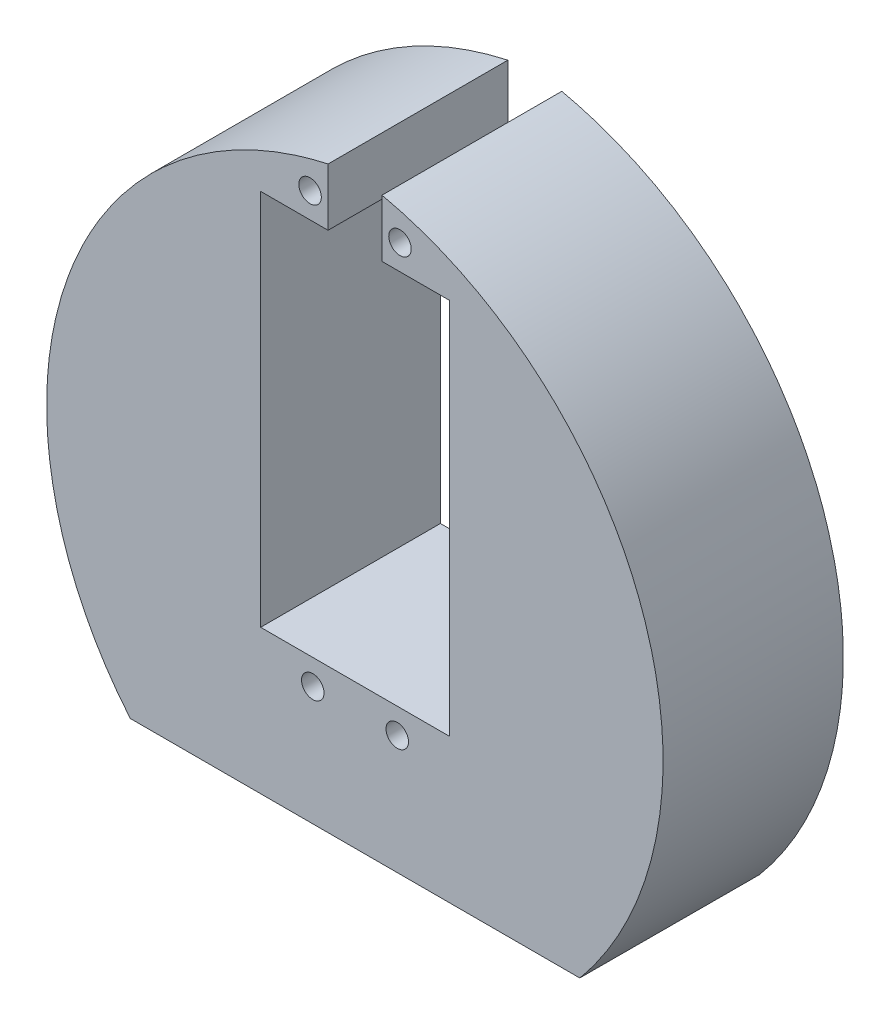
from build123d import *

# Parameters (mm, degrees)
SKETCH5_R          = 1.25
CUT_EXTRUDE1_DEPTH = 22
SKETCH6_R          = 7
CUT_EXTRUDE2_DEPTH = 15


with BuildPart() as part:
    # Surface-Knit1: read off the stored shape, not the designer's step
    # Surface-Knit1: loft between two sections, ruled curve by curve
    surface_knit1_from = [
        Edge.make_bspline([(2.083333333, 65, 0), (0.646232747, 64.800559216, 0), (-0.826702854, 64.515993467, 0), (-3.818616425, 63.749425521, 0), (-5.337603105, 63.267310443, 0), (-8.386455572, 62.082263598, 0), (-9.916283922, 61.37920281, 0), (-12.942411074, 59.736543691, 0), (-14.438613707, 58.796821883, 0), (-17.345798661, 56.676662259, 0), (-18.756625413, 55.496137115, 0), (-21.437875212, 52.905022069, 0), (-22.708100878, 51.494412766, 0), (-25.054855252, 48.47033026, 0), (-26.131181002, 46.856926203, 0), (-28.044894258, 43.470320821, 0), (-28.882119317, 41.697275034, 0), (-30.286104482, 38.046913607, 0), (-30.852782543, 36.169811281, 0), (-31.701669093, 32.373657167, 0), (-31.983893935, 30.454829684, 0), (-32.268420202, 26.637582521, 0), (-32.270825943, 24.73935017, 0), (-32.016934112, 21.019334498, 0), (-31.760796053, 19.197669041, 0), (-31.023611092, 15.67582868, 0), (-30.542738185, 13.975693203, 0), (-29.397291667, 10.728582673, 0), (-28.732872183, 9.18158041, 0), (-27.26390999, 6.258912542, 0), (-26.459481527, 4.883176255, 0), (-24.752359253, 2.309286831, 0), (-23.849734618, 1.111044068, 0), (-22.916666667, 0, 0)], [0, 0, 0, 0, 0.0625, 0.0625, 0.125, 0.125, 0.1875, 0.1875, 0.25, 0.25, 0.3125, 0.3125, 0.375, 0.375, 0.4375, 0.4375, 0.5, 0.5, 0.5625, 0.5625, 0.625, 0.625, 0.6875, 0.6875, 0.75, 0.75, 0.8125, 0.8125, 0.875, 0.875, 0.9375, 0.9375, 1, 1, 1, 1], 3),
        Edge.make_bspline([(27.083333333, 0, 0), (28.016401284, 1.111044068, 0), (28.91902592, 2.309286831, 0), (30.626148194, 4.883176255, 0), (31.430576657, 6.258912542, 0), (32.89953885, 9.18158041, 0), (33.563958334, 10.728582673, 0), (34.709404851, 13.975693203, 0), (35.190277759, 15.67582868, 0), (35.92746272, 19.197669041, 0), (36.183600779, 21.019334498, 0), (36.437492609, 24.73935017, 0), (36.435086869, 26.637582521, 0), (36.150560602, 30.454829684, 0), (35.868335759, 32.373657167, 0), (35.019449209, 36.169811281, 0), (34.452771148, 38.046913607, 0), (33.048785984, 41.697275034, 0), (32.211560925, 43.470320821, 0), (30.297847668, 46.856926203, 0), (29.221521919, 48.47033026, 0), (26.874767544, 51.494412766, 0), (25.604541879, 52.905022069, 0), (22.92329208, 55.496137115, 0), (21.512465328, 56.676662259, 0), (18.605280373, 58.796821883, 0), (17.10907774, 59.736543691, 0), (14.082950589, 61.37920281, 0), (12.553122239, 62.082263598, 0), (9.504269772, 63.267310443, 0), (7.985283092, 63.749425521, 0), (4.993369521, 64.515993467, 0), (3.52043392, 64.800559216, 0), (2.083333333, 65, 0)], [0, 0, 0, 0, 0.0625, 0.0625, 0.125, 0.125, 0.1875, 0.1875, 0.25, 0.25, 0.3125, 0.3125, 0.375, 0.375, 0.4375, 0.4375, 0.5, 0.5, 0.5625, 0.5625, 0.625, 0.625, 0.6875, 0.6875, 0.75, 0.75, 0.8125, 0.8125, 0.875, 0.875, 0.9375, 0.9375, 1, 1, 1, 1], 3),
        Edge.make_line((27.083333333, 0, 0), (-22.916666667, 0, 0)),
    ]
    surface_knit1_to = [
        Edge.make_bspline([(2.083333333, 65, 20), (0.647068043, 64.800424513, 20), (-0.824969306, 64.515786234, 20), (-3.814978177, 63.749245223, 20), (-5.332958295, 63.267229827, 20), (-8.379725343, 62.08260226, 20), (-9.908474817, 61.379861368, 20), (-12.932428528, 59.73810206, 20), (-14.427536732, 58.798960501, 20), (-17.332592911, 56.680243894, 20), (-18.742385636, 55.500581799, 20), (-21.421715644, 52.911470639, 20), (-22.691056015, 51.502002286, 20), (-25.036276618, 48.480441163, 20), (-26.111954405, 46.8684174, 20), (-28.024682221, 43.48474031, 20), (-28.861570209, 41.713242126, 20), (-30.265236079, 38.066046457, 20), (-30.831932078, 36.190561729, 20), (-31.681215411, 32.397605605, 20), (-31.963818965, 30.480357956, 20), (-32.24943077, 26.666132321, 20), (-32.252542967, 24.76934126, 20), (-32.000328363, 21.051990902, 20), (-31.745160599, 19.231549308, 20), (-31.010098955, 15.711890824, 20), (-30.530378628, 14.01271343, 20), (-29.387334902, 10.767236468, 20), (-28.724165314, 9.220909913, 20), (-27.257723578, 6.29932121, 20), (-26.454565517, 4.923988664, 20), (-24.749943011, 2.350663913, 20), (-23.848547718, 1.152582349, 20), (-22.916666667, 0.041598071, 20)], [0, 0, 0, 0, 0.0625, 0.0625, 0.125, 0.125, 0.1875, 0.1875, 0.25, 0.25, 0.3125, 0.3125, 0.375, 0.375, 0.4375, 0.4375, 0.5, 0.5, 0.5625, 0.5625, 0.625, 0.625, 0.6875, 0.6875, 0.75, 0.75, 0.8125, 0.8125, 0.875, 0.875, 0.9375, 0.9375, 1, 1, 1, 1], 3),
        Edge.make_bspline([(27.083333333, 0.041598071, 20), (28.013324474, 1.15416485, 20), (28.912650953, 2.353624766, 20), (30.612882601, 4.929167074, 20), (31.413718634, 6.305337934, 20), (32.875425295, 9.227959299, 20), (33.536182318, 10.774479235, 20), (34.674523423, 14.019650076, 20), (35.151954723, 15.718327197, 20), (35.882803171, 19.236326493, 20), (36.136048243, 21.05560894, 20), (36.385015288, 24.770116129, 20), (36.380579809, 26.665223747, 20), (36.093095417, 30.475786604, 20), (35.809943747, 32.391056326, 20), (34.960413899, 36.18005484, 20), (34.394019828, 38.053561803, 20), (32.991758511, 41.697107973, 20), (32.155972434, 43.466936274, 20), (30.246080794, 46.847842163, 20), (29.172135744, 48.458765813, 20), (26.830760169, 51.478864648, 20), (25.563530264, 52.887971076, 20), (22.888516003, 55.477149894, 20), (21.480926996, 56.657240939, 20), (18.58010928, 58.777551077, 20), (17.087034883, 59.717856056, 20), (14.066775655, 61.362540967, 20), (12.539686611, 62.06704278, 20), (9.495740577, 63.255611058, 20), (7.978921334, 63.739805204, 20), (4.990683697, 64.510935324, 20), (3.51925729, 64.797983291, 20), (2.083333333, 65, 20)], [0, 0, 0, 0, 0.0625, 0.0625, 0.125, 0.125, 0.1875, 0.1875, 0.25, 0.25, 0.3125, 0.3125, 0.375, 0.375, 0.4375, 0.4375, 0.5, 0.5, 0.5625, 0.5625, 0.625, 0.625, 0.6875, 0.6875, 0.75, 0.75, 0.8125, 0.8125, 0.875, 0.875, 0.9375, 0.9375, 1, 1, 1, 1], 3),
        Edge.make_line((27.083333333, 0.041598071, 20), (-22.916666667, 0.041598071, 20)),
    ]
    surface_knit1 = Solid(Shell([*[Face.make_surface_from_curves(surface_knit1_from[k], surface_knit1_to[k]) for k in range(3)], Face(Wire(surface_knit1_from)), Face(Wire(surface_knit1_to))]))
    add(surface_knit1)

    # Sketch5 → Cut-Extrude1 (cut)
    with BuildSketch(Plane.XY.offset(20)):
        with Locations((-2.616666667, 13.268765789)):
            Circle(SKETCH5_R)
        with Locations((-2.916666667, 60.888765789)):
            Circle(SKETCH5_R)
        with Locations(Location((6.783333333, 13.268765789, 0), (0, 0, 180))):
            Circle(SKETCH5_R)
        with Locations(Location((7.083333333, 60.888765789, 0), (0, 0, 180))):
            Circle(SKETCH5_R)
        Polygon((12.583333333, 16.078765789), (-8.416666667, 16.078765789), (-8.416666667, 58.078765789), (-0.916666667, 58.078765789), (-0.916666667, 65.078765789), (5.083333333, 65.078765789), (5.083333333, 58.078765789), (12.583333333, 58.078765789), align=None)
    extrude(amount=-CUT_EXTRUDE1_DEPTH, mode=Mode.SUBTRACT)

    # Sketch6 → Cut-Extrude2 (cut)
    with BuildSketch(Plane(origin=(0, 0, 0), x_dir=(1, 0, 0), z_dir=(0, 1, 0))):
        with Locations(Location((-14.916666667, -10, 0), (0, 0, 90))):
            Circle(SKETCH6_R)
        with Locations(Location((19.083333333, -10, 0), (0, 0, 90))):
            Circle(SKETCH6_R)
    extrude(amount=CUT_EXTRUDE2_DEPTH, mode=Mode.SUBTRACT)


solid = part.part
